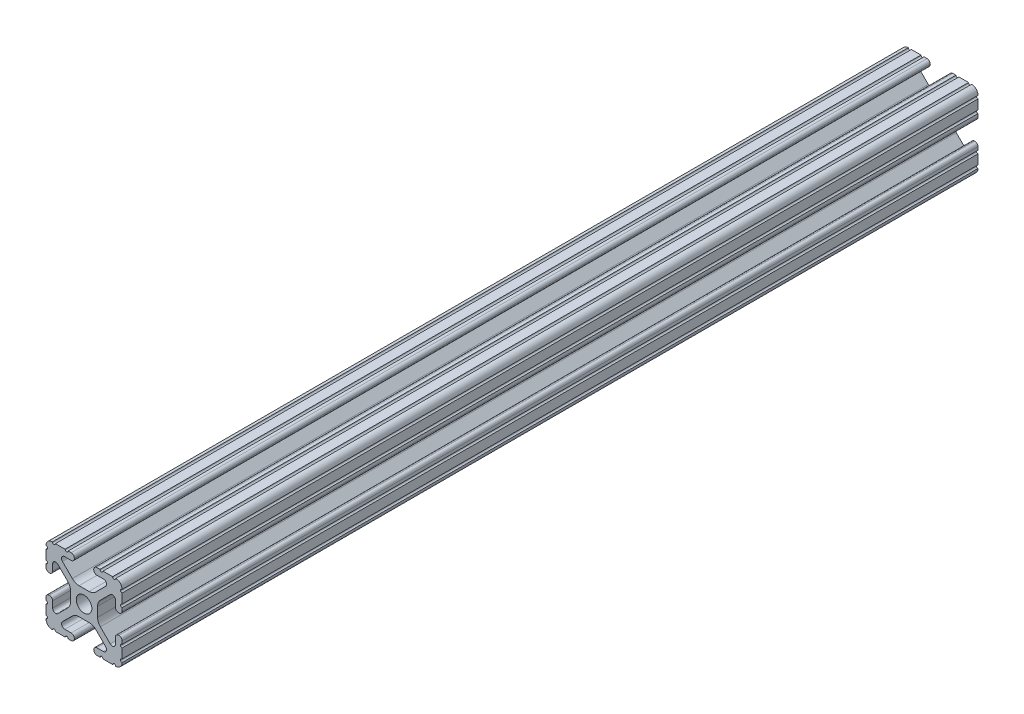
from build123d import *

# Parameters (mm, degrees)
SKETCH1_R           = 2.6035
BOSS_EXTRUDE1_DEPTH = 142.875


with BuildPart() as part:
    # Sketch1 → Boss-Extrude1 (new, symmetric)
    with BuildSketch(Plane.XY):
        with BuildLine():
            Line((-7.179650497, -8.645192506), (-3.952270251, -5.423690499))
            ThreePointArc((-3.952270251, -5.423690499), (-2.922936451, -4.736929036), (-1.709253557, -4.4958))
            Line((-1.709253557, -4.4958), (1.709253557, -4.4958))
            ThreePointArc((1.709253557, -4.4958), (2.922936451, -4.736929036), (3.952270251, -5.423690499))
            Line((3.952270251, -5.423690499), (7.179650497, -8.645192506))
            ThreePointArc((7.179650497, -8.645192506), (7.41473083, -9.822813117), (6.416408329, -10.4902))
            Line((6.416408329, -10.4902), (4.287512407, -10.4902))
            ThreePointArc((4.287512407, -10.4902), (3.54574862, -10.79744862), (3.2385, -11.539212407))
            Line((3.2385, -11.539212407), (3.2385, -11.650987593))
            ThreePointArc((3.2385, -11.650987593), (3.54574862, -12.39275138), (4.287512407, -12.7))
            Line((4.287512407, -12.7), (5.317126718, -12.7))
            ThreePointArc((5.317126718, -12.7), (5.825126718, -12.192), (6.333126718, -12.7))
            Line((6.333126718, -12.7), (9.550443118, -12.7))
            ThreePointArc((9.550443118, -12.7), (10.058366869, -12.192000006), (10.566443095, -12.699847501))
            ThreePointArc((10.566443095, -12.699847501), (12.082537762, -12.08250727), (12.699846982, -10.566399977))
            ThreePointArc((12.699846982, -10.566399977), (12.192000006, -10.058323491), (12.7, -9.5504))
            Line((12.7, -9.5504), (12.7, -6.3330836))
            ThreePointArc((12.7, -6.3330836), (12.192, -5.8250836), (12.7, -5.3170836))
            Line((12.7, -5.3170836), (12.7, -4.287469289))
            ThreePointArc((12.7, -4.287469289), (12.39275138, -3.545705502), (11.650987593, -3.238456882))
            Line((11.650987593, -3.238456882), (11.539212407, -3.238456882))
            ThreePointArc((11.539212407, -3.238456882), (10.79744862, -3.545705502), (10.4902, -4.287469289))
            Line((10.4902, -4.287469289), (10.4902, -6.402089023))
            ThreePointArc((10.4902, -6.402089023), (9.856505071, -7.351067942), (8.737131347, -7.129408934))
            Line((8.737131347, -7.129408934), (5.441005833, -3.840816462))
            ThreePointArc((5.441005833, -3.840816462), (4.750877967, -2.809883091), (4.5085, -1.593185507))
            Line((4.5085, -1.593185507), (4.5085, 1.593185507))
            ThreePointArc((4.5085, 1.593185507), (4.750877967, 2.809883091), (5.441005833, 3.840816462))
            Line((5.441005833, 3.840816462), (8.737131347, 7.129408934))
            ThreePointArc((8.737131347, 7.129408934), (9.856505071, 7.351067942), (10.4902, 6.402089023))
            Line((10.4902, 6.402089023), (10.4902, 4.287469289))
            ThreePointArc((10.4902, 4.287469289), (10.79744862, 3.545705502), (11.539212407, 3.238456882))
            Line((11.539212407, 3.238456882), (11.650987593, 3.238456882))
            ThreePointArc((11.650987593, 3.238456882), (12.39275138, 3.545705502), (12.7, 4.287469289))
            Line((12.7, 4.287469289), (12.7, 5.3170836))
            ThreePointArc((12.7, 5.3170836), (12.192, 5.8250836), (12.7, 6.3330836))
            Line((12.7, 6.3330836), (12.7, 9.5504))
            ThreePointArc((12.7, 9.5504), (12.192000006, 10.058323491), (12.699846982, 10.566399977))
            ThreePointArc((12.699846982, 10.566399977), (12.082537762, 12.08250727), (10.566443095, 12.699847501))
            ThreePointArc((10.566443095, 12.699847501), (10.058366869, 12.192000006), (9.550443118, 12.7))
            Line((9.550443118, 12.7), (6.333126718, 12.7))
            ThreePointArc((6.333126718, 12.7), (5.825126718, 12.192), (5.317126718, 12.7))
            Line((5.317126718, 12.7), (4.287512407, 12.7))
            ThreePointArc((4.287512407, 12.7), (3.54574862, 12.39275138), (3.2385, 11.650987593))
            Line((3.2385, 11.650987593), (3.2385, 11.539212407))
            ThreePointArc((3.2385, 11.539212407), (3.54574862, 10.79744862), (4.287512407, 10.4902))
            Line((4.287512407, 10.4902), (6.476788598, 10.4902))
            ThreePointArc((6.476788598, 10.4902), (7.432222385, 9.85140422), (7.207036008, 8.724370562))
            Line((7.207036008, 8.724370562), (3.898272566, 5.423169045))
            ThreePointArc((3.898272566, 5.423169045), (2.869120213, 4.736787962), (1.655778399, 4.4958))
            Line((1.655778399, 4.4958), (-1.655778399, 4.4958))
            ThreePointArc((-1.655778399, 4.4958), (-2.869120213, 4.736787962), (-3.898272566, 5.423169045))
            Line((-3.898272566, 5.423169045), (-7.207036008, 8.724370562))
            ThreePointArc((-7.207036008, 8.724370562), (-7.432222385, 9.85140422), (-6.476788598, 10.4902))
            Line((-6.476788598, 10.4902), (-4.287512407, 10.4902))
            ThreePointArc((-4.287512407, 10.4902), (-3.54574862, 10.79744862), (-3.2385, 11.539212407))
            Line((-3.2385, 11.539212407), (-3.2385, 11.650987593))
            ThreePointArc((-3.2385, 11.650987593), (-3.54574862, 12.39275138), (-4.287512407, 12.7))
            Line((-4.287512407, 12.7), (-5.317126718, 12.7))
            ThreePointArc((-5.317126718, 12.7), (-5.825126718, 12.192), (-6.333126718, 12.7))
            Line((-6.333126718, 12.7), (-9.550443118, 12.7))
            ThreePointArc((-9.550443118, 12.7), (-10.058366869, 12.192000006), (-10.566443095, 12.699847501))
            ThreePointArc((-10.566443095, 12.699847501), (-12.082537762, 12.08250727), (-12.699846982, 10.566399977))
            ThreePointArc((-12.699846982, 10.566399977), (-12.192000006, 10.058323491), (-12.7, 9.5504))
            Line((-12.7, 9.5504), (-12.7, 6.3330836))
            ThreePointArc((-12.7, 6.3330836), (-12.192, 5.8250836), (-12.7, 5.3170836))
            Line((-12.7, 5.3170836), (-12.7, 4.287469289))
            ThreePointArc((-12.7, 4.287469289), (-12.39275138, 3.545705502), (-11.650987593, 3.238456882))
            Line((-11.650987593, 3.238456882), (-11.539212407, 3.238456882))
            ThreePointArc((-11.539212407, 3.238456882), (-10.79744862, 3.545705502), (-10.4902, 4.287469289))
            Line((-10.4902, 4.287469289), (-10.4902, 6.402089023))
            ThreePointArc((-10.4902, 6.402089023), (-9.856505071, 7.351067942), (-8.737131347, 7.129408934))
            Line((-8.737131347, 7.129408934), (-5.441005833, 3.840816462))
            ThreePointArc((-5.441005833, 3.840816462), (-4.750877967, 2.809883091), (-4.5085, 1.593185507))
            Line((-4.5085, 1.593185507), (-4.5085, -1.593185507))
            ThreePointArc((-4.5085, -1.593185507), (-4.750877967, -2.809883091), (-5.441005833, -3.840816462))
            Line((-5.441005833, -3.840816462), (-8.737131347, -7.129408934))
            ThreePointArc((-8.737131347, -7.129408934), (-9.856505071, -7.351067942), (-10.4902, -6.402089023))
            Line((-10.4902, -6.402089023), (-10.4902, -4.287469289))
            ThreePointArc((-10.4902, -4.287469289), (-10.79744862, -3.545705502), (-11.539212407, -3.238456882))
            Line((-11.539212407, -3.238456882), (-11.650987593, -3.238456882))
            ThreePointArc((-11.650987593, -3.238456882), (-12.39275138, -3.545705502), (-12.7, -4.287469289))
            Line((-12.7, -4.287469289), (-12.7, -5.3170836))
            ThreePointArc((-12.7, -5.3170836), (-12.192, -5.8250836), (-12.7, -6.3330836))
            Line((-12.7, -6.3330836), (-12.7, -9.5504))
            ThreePointArc((-12.7, -9.5504), (-12.192000006, -10.058323491), (-12.699846982, -10.566399977))
            ThreePointArc((-12.699846982, -10.566399977), (-12.082537762, -12.08250727), (-10.566443095, -12.699847501))
            ThreePointArc((-10.566443095, -12.699847501), (-10.058366869, -12.192000006), (-9.550443118, -12.7))
            Line((-9.550443118, -12.7), (-6.333126718, -12.7))
            ThreePointArc((-6.333126718, -12.7), (-5.825126718, -12.192), (-5.317126718, -12.7))
            Line((-5.317126718, -12.7), (-4.287512407, -12.7))
            ThreePointArc((-4.287512407, -12.7), (-3.54574862, -12.39275138), (-3.2385, -11.650987593))
            Line((-3.2385, -11.650987593), (-3.2385, -11.539212407))
            ThreePointArc((-3.2385, -11.539212407), (-3.54574862, -10.79744862), (-4.287512407, -10.4902))
            Line((-4.287512407, -10.4902), (-6.416408329, -10.4902))
            ThreePointArc((-6.416408329, -10.4902), (-7.41473083, -9.822813117), (-7.179650497, -8.645192506))
        make_face()
        Circle(SKETCH1_R, mode=Mode.SUBTRACT)
    extrude(amount=BOSS_EXTRUDE1_DEPTH, both=True)


solid = part.part
